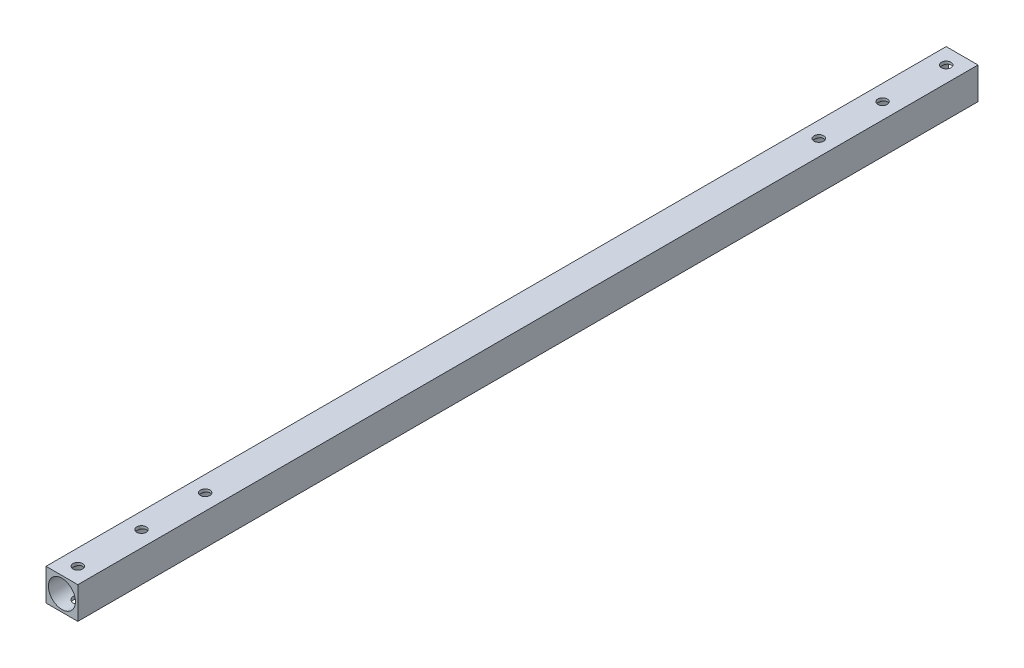
from build123d import *

# Parameters (mm, degrees)
SKETCH1_W           = 10
SKETCH1_H           = 10
SKETCH1_R           = 4.25
BOSS_EXTRUDE1_DEPTH = 282.8
SKETCH2_R           = 1.5
CUT_EXTRUDE1_DEPTH  = 284.020917955


with BuildPart() as part:
    # Sketch1 → Boss-Extrude1 (new body)
    with BuildSketch(Plane.XY):
        Rectangle(SKETCH1_W, SKETCH1_H)
        Circle(SKETCH1_R, mode=Mode.SUBTRACT)
    extrude(amount=BOSS_EXTRUDE1_DEPTH)

    # Sketch2 → Cut-Extrude1 (cut, through all)
    with BuildSketch(Plane(origin=(0, 5, 0), x_dir=(1, 0, 0), z_dir=(0, 1, 0))):
        with Locations((0, -5)):
            Circle(SKETCH2_R)
        with Locations((0, -25)):
            Circle(SKETCH2_R)
        with Locations((0, -45)):
            Circle(SKETCH2_R)
        with Locations((0, -277.8)):
            Circle(SKETCH2_R)
        with Locations((0, -257.8)):
            Circle(SKETCH2_R)
        with Locations((0, -237.8)):
            Circle(SKETCH2_R)
    extrude(amount=-CUT_EXTRUDE1_DEPTH, mode=Mode.SUBTRACT)


solid = part.part
